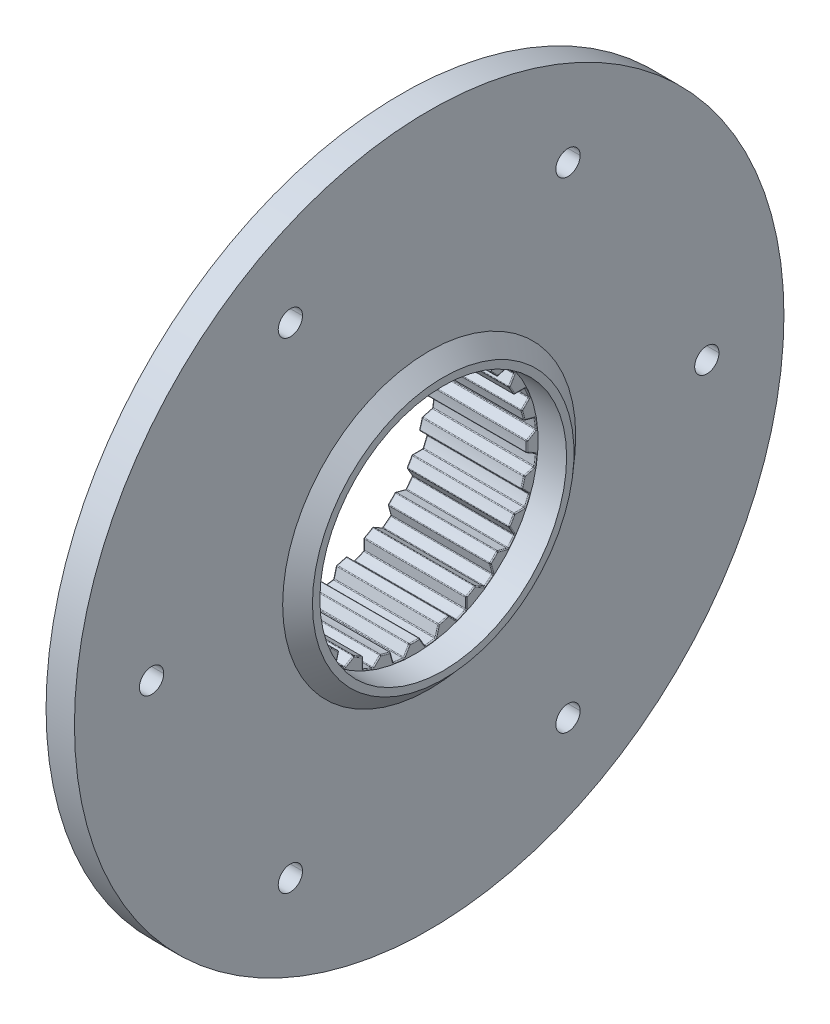
from build123d import *
from build123d.topology import SkipClean

# Parameters (mm, degrees)
SKETCH1_R                = 30.1625
BOSS_EXTRUDE1_DEPTH      = 24.10959999
SKETCH2_R                = 73.025
BOSS_EXTRUDE2_DEPTH      = 5.842
SKETCH3_R                = 25.100000092
CUT_EXTRUDE1_DEPTH       = 107.04986592
BOSS_EXTRUDE3_DEPTH      = 24.10959999
CIRPATTERN2_COUNT        = 24
FILLET3_R                = 3.81
F_5_0_5_DIAMETER_HOLE1_D = 5
CIRPATTERN3_COUNT        = 6
SKETCH11_R               = 30.1625
SKETCH11_R_2             = 27.94
SKETCH11_R_3             = 25.4
BOSS_EXTRUDE4_DEPTH      = 2.890400112
SKETCH24_W               = 2.983480444
SKETCH24_H               = 2.299999972
FILLET8_R                = 0.2


with BuildPart() as part:
    # Sketch1 → Boss-Extrude1 (new body)
    with BuildSketch(Plane(origin=(0, 0, 0), x_dir=(0, 0, -1), z_dir=(1, 0, 0))):
        with Locations(Location((0, 0, 0), (0, 0, 180))):
            Circle(SKETCH1_R)
    extrude(amount=BOSS_EXTRUDE1_DEPTH)

    # Sketch2 → Boss-Extrude2 (add)
    with BuildSketch(Plane(origin=(24.10959999, 0, 0), x_dir=(0, 0, -1), z_dir=(1, 0, 0))):
        Circle(SKETCH2_R)
    extrude(amount=-BOSS_EXTRUDE2_DEPTH)

    # Sketch3 → Cut-Extrude1 (cut, through all)
    with BuildSketch(Plane.ZY):
        Circle(SKETCH3_R)
    extrude(amount=-CUT_EXTRUDE1_DEPTH, mode=Mode.SUBTRACT)

    # Sketch4 → Boss-Extrude3 (add)
    with BuildSketch(Plane.ZY):
        with BuildLine():
            Line((25.005179188, 2.179683093), (23.07541211, 1.065531444))
            ThreePointArc((23.07541211, 1.065531444), (23.100000028, 0), (23.07541211, -1.065531444))
            Line((23.07541211, -1.065531444), (25.005179188, -2.179683093))
            ThreePointArc((25.005179188, -2.179683093), (25.100000092, 0), (25.005179188, 2.179683093))
        make_face()
    boss_extrude3 = extrude(amount=-BOSS_EXTRUDE3_DEPTH)

    # CirPattern2: Boss-Extrude3 ×24 about axis
    cirpattern2_axis = Axis((0, 0, 0), (1, 0, 0))
    for i in range(1, CIRPATTERN2_COUNT):
        add(boss_extrude3.rotate(cirpattern2_axis, i * 360 / CIRPATTERN2_COUNT))

    # Fillet3
    fillet3_edges = [part.edges().sort_by_distance(p)[0] for p in [
        (0, 0, -30.1625),
    ]]
    fillet(fillet3_edges, radius=FILLET3_R)

    # Ø5.0 (5) Diameter Hole1 (through all)
    with Locations(Plane(origin=(24.10959999, 0, 0), x_dir=(0, 0, -1), z_dir=(1, 0, 0))):
        with Locations((-57.15, 0)):
            f_5_0_5_diameter_hole1 = Hole(F_5_0_5_DIAMETER_HOLE1_D / 2)

    # CirPattern3: Ø5.0 (5) Diameter Hole1 ×6 about axis
    cirpattern3_axis = Axis((0, 0, 0), (1, 0, 0))
    for i in range(1, CIRPATTERN3_COUNT):
        add(f_5_0_5_diameter_hole1.rotate(cirpattern3_axis, i * 360 / CIRPATTERN3_COUNT), mode=Mode.SUBTRACT)

    # Sketch11 → Boss-Extrude4 (add)
    # profile 1 of 2: a face of its own
    with BuildSketch(Plane(origin=(24.10959999, 0, 0), x_dir=(0, 0, -1), z_dir=(1, 0, 0))):
        with Locations(Location((0, 0, 0), (0, 0, 180))):
            Circle(SKETCH11_R)
        Circle(SKETCH11_R_2, mode=Mode.SUBTRACT)
    # profile 2 of 2: a face of its own
    with BuildSketch(Plane(origin=(24.10959999, 0, 0), x_dir=(0, 0, -1), z_dir=(1, 0, 0))):
        Circle(SKETCH11_R_2)
        Circle(SKETCH11_R_3, mode=Mode.SUBTRACT)
    extrude(amount=BOSS_EXTRUDE4_DEPTH)

    # Sketch13 → Cut-Revolve2 (revolve, cut)
    with BuildSketch(Plane.XY, mode=Mode.PRIVATE) as cut_revolve2_sk:
        Polygon((27.000000102, -26.922648654), (27.000000102, -30.1625), (24.10959999, -30.1625), align=None)
    revolve(cut_revolve2_sk.sketch.rotate(Axis((0, 0, 0), (1, 0, 0)), 90), axis=Axis((0, 0, 0), (1, 0, 0)), mode=Mode.SUBTRACT)

    # Sketch24 → Cut-Revolve3 (revolve, cut)
    with SkipClean():  # the faces are left unmerged after this step: merging them gives an invalid solid
        with BuildSketch(Plane(origin=(0, 0, 0), x_dir=(1, 0, 0), z_dir=(0, 1, 0)), mode=Mode.PRIVATE) as cut_revolve3_sk:
            with Locations((22.617859768, 24.250000014)):
                Rectangle(SKETCH24_W, SKETCH24_H)
        revolve(cut_revolve3_sk.sketch.rotate(Axis((0, 0, 0), (1, 0, 0)), 180), axis=Axis((0, 0, 0), (1, 0, 0)), mode=Mode.SUBTRACT)
    add(part.part.scale(1), mode=Mode.REPLACE)  # the faces are merged on a copy

    # Fillet8
    fillet8_edges = [part.edges().sort_by_distance(p)[0] for p in [
        (0, -23.189376351, -9.605354188),
        (0, -21.630810381, -10.61492871),
        (0, -20.005186852, -11.550000014),
        (0, -20.008203112, -13.425366939),
        (0, -19.913168914, -15.279911924),
        (0, -18.146412678, -15.851699472),
        (0, -16.334166665, -16.334166665),
        (0, -15.851699472, -18.146412678),
        (0, -15.279911924, -19.913168914),
        (0, -13.425366939, -20.008203112),
        (0, -11.550000014, -20.005186852),
        (0, -10.61492871, -21.630810381),
        (0, 3.276207437, 24.885266112),
        (0, -9.605354188, -23.189376351),
        (0, -7.78940463, -22.801180775),
        (0, -5.978719949, -22.312886614),
        (0, -4.654768097, -23.641104103),
        (0, -3.276207437, -24.885266112),
        (0, -1.622607269, -24.040295649),
        (0, 0, -23.100000028),
        (0, 1.622607269, -24.040295649),
        (0, 3.276207437, -24.885266112),
        (0, 4.654768097, -23.641104103),
        (0, 5.978719949, -22.312886614),
        (0, 7.78940463, -22.801180775),
        (0, 9.605354188, -23.189376351),
        (0, 10.61492871, -21.630810381),
        (0, 11.550000014, -20.005186852),
        (0, 13.425366939, -20.008203112),
        (0, 15.279911924, -19.913168914),
        (0, 15.851699472, -18.146412678),
        (0, 16.334166665, -16.334166665),
        (0, 18.146412678, -15.851699472),
        (0, 1.622607269, 24.040295649),
        (0, 19.913168914, -15.279911924),
        (0, 0, 23.100000028),
        (0, 20.008203112, -13.425366939),
        (0, 20.005186852, -11.550000014),
        (0, 21.630810381, -10.61492871),
        (0, -1.622607269, 24.040295649),
        (0, 23.189376351, -9.605354188),
        (0, 22.801180775, -7.78940463),
        (0, 22.312886614, -5.978719949),
        (0, 23.641104103, -4.654768097),
        (0, 24.885266112, -3.276207437),
        (0, 24.040295649, -1.622607269),
        (0, 23.100000028, 0),
        (0, 24.040295649, 1.622607269),
        (0, 24.885266112, 3.276207437),
        (0, 23.641104103, 4.654768097),
        (0, 22.312886614, 5.978719949),
        (0, 22.801180775, 7.78940463),
        (0, 23.189376351, 9.605354188),
        (0, 21.630810381, 10.61492871),
        (0, 20.005186852, 11.550000014),
        (0, 20.008203112, 13.425366939),
        (0, 19.913168914, 15.279911924),
        (0, 18.146412678, 15.851699472),
        (0, 16.334166665, 16.334166665),
        (0, 15.851699472, 18.146412678),
        (0, 15.279911924, 19.913168914),
        (0, 13.425366939, 20.008203112),
        (0, 11.550000014, 20.005186852),
        (0, 10.61492871, 21.630810381),
        (0, 9.605354188, 23.189376351),
        (0, 7.78940463, 22.801180775),
        (0, 5.978719949, 22.312886614),
        (0, 4.654768097, 23.641104103),
        (0, -3.276207437, 24.885266112),
        (0, -4.654768097, 23.641104103),
        (0, -5.978719949, 22.312886614),
        (0, -7.78940463, 22.801180775),
        (10.563059773, 4.943131787, 22.56491634),
        (10.563059773, 4.366404407, 24.717291866),
        (21.126119546, 4.654768097, 23.641104103),
        (10.563059773, 7.001580468, 22.013356678),
        (10.563059773, 8.577228793, 23.589004872),
        (10.563059773, 10.614928756, 20.516658812),
        (10.563059773, 10.614928663, 22.74496195),
        (10.563059773, 12.460483354, 19.451127368),
        (10.563059773, 14.390250525, 20.565278856),
        (10.563059773, 15.563335872, 17.070224891),
        (10.563059773, 16.140063073, 19.222600465),
        (10.563059773, 17.070224891, 15.563335872),
        (10.563059773, 19.222600465, 16.140063073),
        (10.563059773, 19.451127368, 12.460483354),
        (10.563059773, 20.565278856, 14.390250525),
        (10.563059773, 20.516658812, 10.614928756),
        (10.563059773, 22.74496195, 10.614928663),
        (10.563059773, 22.013356678, 7.001580468),
        (10.563059773, 23.589004872, 8.577228793),
        (10.563059773, 22.56491634, 4.943131787),
        (10.563059773, 24.717291866, 4.366404407),
        (10.563059773, 23.07541211, 1.065531444),
        (10.563059773, 25.005179188, 2.179683093),
        (10.563059773, 23.07541211, -1.065531444),
        (10.563059773, 25.005179188, -2.179683093),
        (10.563059773, 22.56491634, -4.943131787),
        (10.563059773, 24.717291866, -4.366404407),
        (10.563059773, 22.013356678, -7.001580468),
        (10.563059773, 23.589004872, -8.577228793),
        (10.563059773, 20.516658812, -10.614928756),
        (10.563059773, 22.74496195, -10.614928663),
        (10.563059773, 19.451127368, -12.460483354),
        (10.563059773, 20.565278856, -14.390250525),
        (10.563059773, 17.070224891, -15.563335872),
        (10.563059773, 19.222600465, -16.140063073),
        (10.563059773, 15.563335872, -17.070224891),
        (0, -9.605354188, 23.189376351),
        (10.563059773, 16.140063073, -19.222600465),
        (10.563059773, 12.460483354, -19.451127368),
        (10.563059773, 14.390250525, -20.565278856),
        (10.563059773, 10.614928756, -20.516658812),
        (10.563059773, 10.614928663, -22.74496195),
        (10.563059773, 7.001580468, -22.013356678),
        (10.563059773, 8.577228793, -23.589004872),
        (10.563059773, 4.943131787, -22.56491634),
        (10.563059773, 4.366404407, -24.717291866),
        (10.563059773, 1.065531444, -23.07541211),
        (10.563059773, 2.179683093, -25.005179188),
        (10.563059773, -1.065531444, -23.07541211),
        (10.563059773, -2.179683093, -25.005179188),
        (10.563059773, -4.943131787, -22.56491634),
        (10.563059773, -4.366404407, -24.717291866),
        (10.563059773, -7.001580468, -22.013356678),
        (10.563059773, -8.577228793, -23.589004872),
        (10.563059773, -10.614928756, -20.516658812),
        (10.563059773, -10.614928663, -22.74496195),
        (10.563059773, -12.460483354, -19.451127368),
        (10.563059773, -14.390250525, -20.565278856),
        (10.563059773, -15.563335872, -17.070224891),
        (10.563059773, -16.140063073, -19.222600465),
        (10.563059773, -17.070224891, -15.563335872),
        (10.563059773, -19.222600465, -16.140063073),
        (10.563059773, -19.451127368, -12.460483354),
        (10.563059773, -20.565278856, -14.390250525),
        (10.563059773, -20.516658812, -10.614928756),
        (10.563059773, -22.74496195, -10.614928663),
        (10.563059773, -22.013356678, -7.001580468),
        (10.563059773, -23.589004872, -8.577228793),
        (10.563059773, -22.56491634, -4.943131787),
        (10.563059773, -24.717291866, -4.366404407),
        (10.563059773, -23.07541211, -1.065531444),
        (10.563059773, -25.005179188, -2.179683093),
        (0, -10.61492871, 21.630810381),
        (10.563059773, -23.07541211, 1.065531444),
        (10.563059773, -25.005179188, 2.179683093),
        (10.563059773, -22.56491634, 4.943131787),
        (10.563059773, -24.717291866, 4.366404407),
        (10.563059773, -22.013356678, 7.001580468),
        (0, -11.550000014, 20.005186852),
        (10.563059773, -23.589004872, 8.577228793),
        (10.563059773, -20.516658812, 10.614928756),
        (10.563059773, -22.74496195, 10.614928663),
        (10.563059773, -19.451127368, 12.460483354),
        (10.563059773, -20.565278856, 14.390250525),
        (0, -13.425366939, 20.008203112),
        (10.563059773, -17.070224891, 15.563335872),
        (10.563059773, -19.222600465, 16.140063073),
        (10.563059773, -15.563335872, 17.070224891),
        (10.563059773, -16.140063073, 19.222600465),
        (10.563059773, -12.460483354, 19.451127368),
        (10.563059773, -14.390250525, 20.565278856),
        (10.563059773, -10.614928756, 20.516658812),
        (10.563059773, -10.614928663, 22.74496195),
        (10.563059773, -7.001580468, 22.013356678),
        (10.563059773, -8.577228793, 23.589004872),
        (10.563059773, -4.943131787, 22.56491634),
        (10.563059773, -4.366404407, 24.717291866),
        (10.563059773, -1.065531444, 23.07541211),
        (10.563059773, -2.179683093, 25.005179188),
        (10.563059773, 1.065531444, 23.07541211),
        (10.563059773, 2.179683093, 25.005179188),
        (21.126119546, -3.276207437, 24.885266112),
        (21.126119546, -9.605354188, 23.189376351),
        (21.126119546, -15.279911924, 19.913168914),
        (21.126119546, -19.913168914, 15.279911924),
        (21.126119546, -23.189376351, 9.605354188),
        (21.126119546, -24.885266112, 3.276207437),
        (21.126119546, -24.885266112, -3.276207437),
        (21.126119546, -23.189376351, -9.605354188),
        (21.126119546, -19.913168914, -15.279911924),
        (21.126119546, -15.279911924, -19.913168914),
        (21.126119546, -9.605354188, -23.189376351),
        (21.126119546, -3.276207437, -24.885266112),
        (21.126119546, 3.276207437, -24.885266112),
        (21.126119546, 9.605354188, -23.189376351),
        (21.126119546, 15.279911924, -19.913168914),
        (21.126119546, 19.913168914, -15.279911924),
        (21.126119546, 23.189376351, -9.605354188),
        (21.126119546, 24.885266112, -3.276207437),
        (21.126119546, 24.885266112, 3.276207437),
        (21.126119546, 23.189376351, 9.605354188),
        (21.126119546, 19.913168914, 15.279911924),
        (21.126119546, 15.279911924, 19.913168914),
        (21.126119546, 9.605354188, 23.189376351),
        (21.126119546, 3.276207437, 24.885266112),
        (21.126119546, 0, 23.100000028),
        (21.126119546, -5.978719949, 22.312886614),
        (21.126119546, -11.550000014, 20.005186852),
        (21.126119546, -16.334166665, 16.334166665),
        (21.126119546, -20.005186852, 11.550000014),
        (21.126119546, -22.312886614, 5.978719949),
        (21.126119546, -23.100000028, 0),
        (21.126119546, -22.312886614, -5.978719949),
        (21.126119546, -20.005186852, -11.550000014),
        (21.126119546, -16.334166665, -16.334166665),
        (21.126119546, -11.550000014, -20.005186852),
        (21.126119546, -5.978719949, -22.312886614),
        (21.126119546, 0, -23.100000028),
        (21.126119546, 5.978719949, -22.312886614),
        (21.126119546, 11.550000014, -20.005186852),
        (21.126119546, 16.334166665, -16.334166665),
        (21.126119546, 20.005186852, -11.550000014),
        (21.126119546, 22.312886614, -5.978719949),
        (21.126119546, 23.100000028, 0),
        (21.126119546, 22.312886614, 5.978719949),
        (21.126119546, 20.005186852, 11.550000014),
        (21.126119546, 16.334166665, 16.334166665),
        (21.126119546, 11.550000014, 20.005186852),
        (21.126119546, -1.622607269, 24.040295649),
        (21.126119546, -4.654768097, 23.641104103),
        (21.126119546, -7.78940463, 22.801180775),
        (21.126119546, -10.61492871, 21.630810381),
        (21.126119546, -13.425366939, 20.008203112),
        (21.126119546, -15.851699472, 18.146412678),
        (21.126119546, -18.146412678, 15.851699472),
        (21.126119546, -20.008203112, 13.425366939),
        (21.126119546, -21.630810381, 10.61492871),
        (21.126119546, -22.801180775, 7.78940463),
        (21.126119546, -23.641104103, 4.654768097),
        (21.126119546, -24.040295649, 1.622607269),
        (21.126119546, -24.040295649, -1.622607269),
        (21.126119546, -23.641104103, -4.654768097),
        (21.126119546, -22.801180775, -7.78940463),
        (21.126119546, -21.630810381, -10.61492871),
        (21.126119546, -20.008203112, -13.425366939),
        (21.126119546, -18.146412678, -15.851699472),
        (21.126119546, -15.851699472, -18.146412678),
        (21.126119546, -13.425366939, -20.008203112),
        (21.126119546, -10.61492871, -21.630810381),
        (21.126119546, -7.78940463, -22.801180775),
        (21.126119546, -4.654768097, -23.641104103),
        (21.126119546, -1.622607269, -24.040295649),
        (21.126119546, 1.622607269, -24.040295649),
        (21.126119546, 4.654768097, -23.641104103),
        (21.126119546, 7.78940463, -22.801180775),
        (21.126119546, 10.61492871, -21.630810381),
        (21.126119546, 13.425366939, -20.008203112),
        (21.126119546, 15.851699472, -18.146412678),
        (21.126119546, 18.146412678, -15.851699472),
        (21.126119546, 20.008203112, -13.425366939),
        (21.126119546, 21.630810381, -10.61492871),
        (21.126119546, 22.801180775, -7.78940463),
        (21.126119546, 23.641104103, -4.654768097),
        (21.126119546, 24.040295649, -1.622607269),
        (21.126119546, 24.040295649, 1.622607269),
        (21.126119546, 23.641104103, 4.654768097),
        (21.126119546, 22.801180775, 7.78940463),
        (21.126119546, 21.630810381, 10.61492871),
        (21.126119546, 20.008203112, 13.425366939),
        (21.126119546, 18.146412678, 15.851699472),
        (21.126119546, 15.851699472, 18.146412678),
        (21.126119546, 13.425366939, 20.008203112),
        (21.126119546, 10.61492871, 21.630810381),
        (21.126119546, 7.78940463, 22.801180775),
        (21.126119546, 1.622607269, 24.040295649),
        (21.126119546, 5.978719949, 22.312886614),
        (0, -15.279911924, 19.913168914),
        (0, -15.851699472, 18.146412678),
        (0, -16.334166665, 16.334166665),
        (0, -18.146412678, 15.851699472),
        (0, -19.913168914, 15.279911924),
        (0, -20.008203112, 13.425366939),
        (0, -20.005186852, 11.550000014),
        (0, -21.630810381, 10.61492871),
        (0, -23.189376351, 9.605354188),
        (0, -22.801180775, 7.78940463),
        (0, -22.312886614, 5.978719949),
        (0, -23.641104103, 4.654768097),
        (0, -24.885266112, 3.276207437),
        (0, -24.040295649, 1.622607269),
        (0, -23.100000028, 0),
        (0, -24.040295649, -1.622607269),
        (0, -24.885266112, -3.276207437),
        (0, -23.641104103, -4.654768097),
        (0, -22.312886614, -5.978719949),
        (0, -22.801180775, -7.78940463),
    ]]
    fillet(fillet8_edges, radius=FILLET8_R)


solid = part.part
